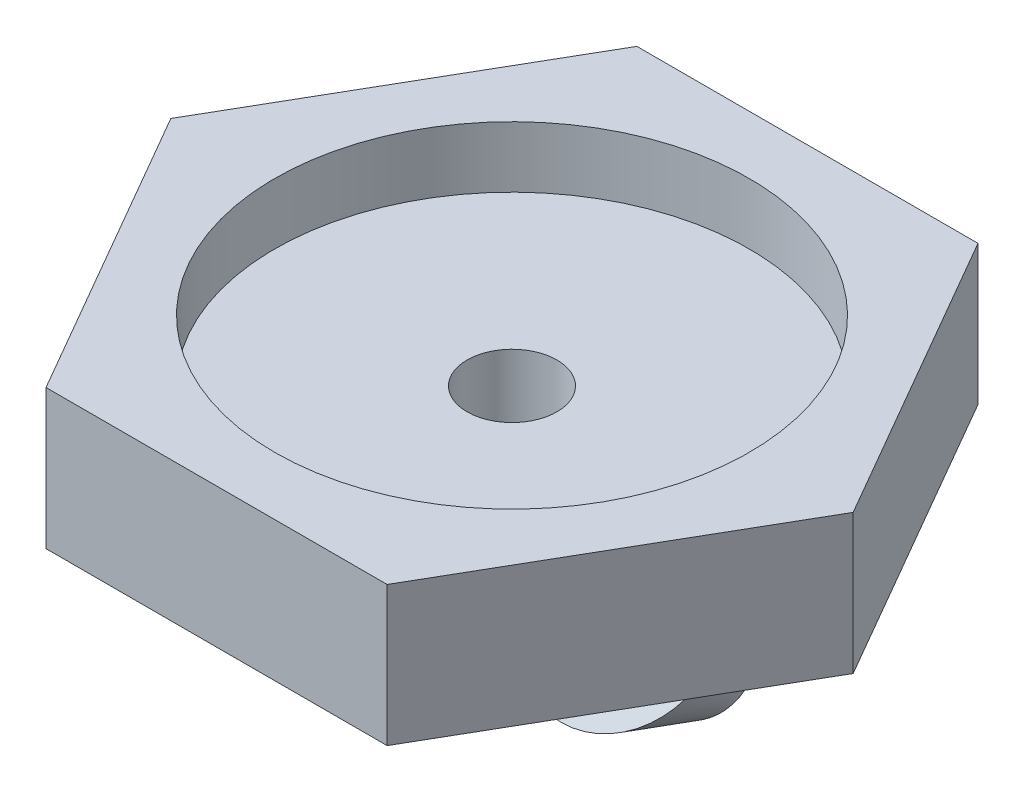
from build123d import *

# Parameters (mm, degrees)
MAINHOLDER_DEPTH   = 7.5
SKETCH12_R         = 12.75
MAGNETCUTOUT_DEPTH = 3.28
MAGNETHOLE_REACH   = 26.614
SKETCH13_R         = 2.415
DRAINOPENING_R     = 2.415
DRAINOPENING_R_2   = 1.125


with BuildPart() as part:
    # Sketch11 → MainHolder (new body)
    with BuildSketch(Plane(origin=(0, 0, 0), x_dir=(1, 0, 0), z_dir=(0, 1, 0))):
        Polygon((18.330871047, 0), (9.165435523, 15.875), (-9.165435523, 15.875), (-18.330871047, 0), (-9.165435523, -15.875), (9.165435523, -15.875), align=None)
    extrude(amount=MAINHOLDER_DEPTH)

    # Sketch12 → MagnetCutout (cut)
    with BuildSketch(Plane(origin=(0, 7.5, 0), x_dir=(1, 0, 0), z_dir=(0, 1, 0))):
        Circle(SKETCH12_R)
    extrude(amount=-MAGNETCUTOUT_DEPTH, mode=Mode.SUBTRACT)

    # Sketch13 → MagnetHole (cut, up to next)
    with BuildSketch(Plane(origin=(0, 4.22, 0), x_dir=(1, 0, 0), z_dir=(0, 1, 0)), mode=Mode.PRIVATE) as magnethole_sk1:
        Circle(SKETCH13_R)
    magnethole_tool1 = extrude(magnethole_sk1.sketch, amount=-MAGNETHOLE_REACH, mode=Mode.PRIVATE) & part.part
    add(magnethole_tool1.solids().sort_by_distance((0, 4.22, 0))[0], mode=Mode.SUBTRACT)


with BuildPart() as body_2:
    # Drain: sweep along a path in DrainPath
    with BuildLine(Plane(origin=(0, 0, 0), x_dir=(0, 0, -1), z_dir=(1, 0, 0))) as drain_path:
        Line((0, 0), (0, -0.917806384))
        ThreePointArc((0, -0.917806384), (0.456722805, -3.213906978), (1.757359313, -5.160447071))
        Line((1.757359313, -5.160447071), (10.242640687, -13.645728445))
    # DrainOpening → Drain (sweep)
    with BuildSketch(Plane.XZ):
        Circle(DRAINOPENING_R)
        Circle(DRAINOPENING_R_2, mode=Mode.SUBTRACT)
    sweep(path=drain_path.line)

    # BarbOutline → Barb (revolve)
    with BuildSketch(Plane(origin=(0, 0, 0), x_dir=(0, -0.7071067811865462, -0.7071067811865489), z_dir=(-1, 0, 0))):
        Polygon((16.891627805, -0.008653569), (10.891627805, -0.008653569), (10.891627805, -2.343653569), align=None)
    revolve(axis=Axis((0, -4.364951942, -0.961864184), (0, -0.7071067811865461, -0.7071067811865489)))


solid = Compound([part.part, body_2.part])
